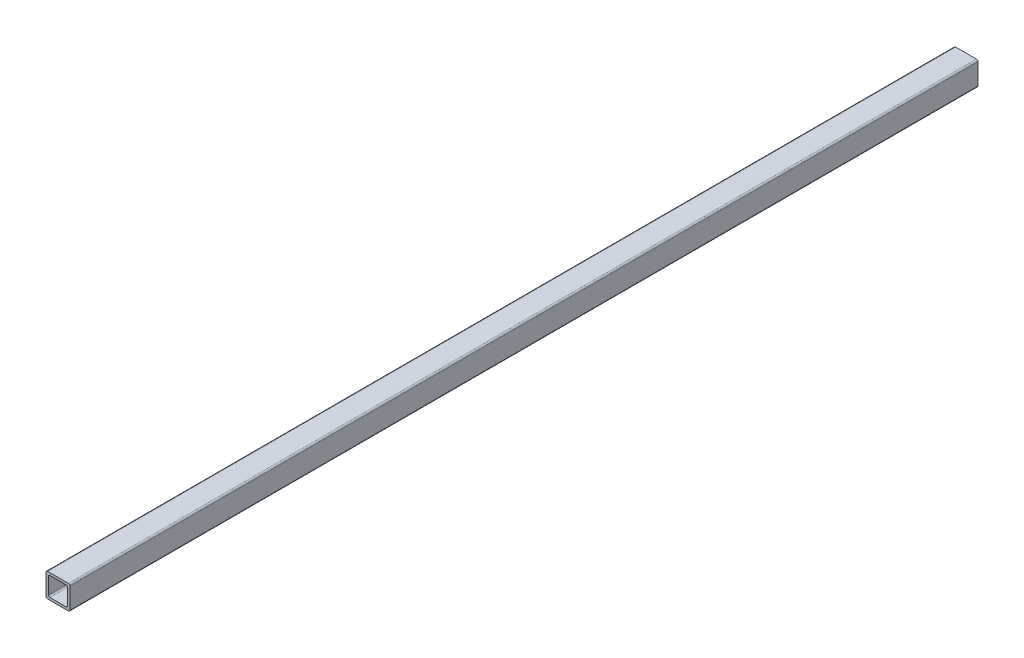
from build123d import *

# Parameters (mm, degrees)
SKETCH1_W           = 7.9
SKETCH1_H           = 7.9
SKETCH1_W_2         = 6.3
SKETCH1_H_2         = 6.3
BOSS_EXTRUDE1_DEPTH = 300
FILLET1_R           = 0.5


with BuildPart() as part:
    # Sketch1 → Boss-Extrude1 (new body)
    with BuildSketch(Plane.XY):
        Rectangle(SKETCH1_W, SKETCH1_H)
        Rectangle(SKETCH1_W_2, SKETCH1_H_2, mode=Mode.SUBTRACT)
    extrude(amount=BOSS_EXTRUDE1_DEPTH)

    # Fillet1
    fillet1_edges = [part.edges().sort_by_distance(p)[0] for p in [
        (3.95, 3.95, 150),
        (3.15, 3.15, 150),
        (3.95, -3.95, 150),
        (3.15, -3.15, 150),
        (-3.15, -3.15, 150),
        (-3.95, -3.95, 150),
        (-3.95, 3.95, 150),
        (-3.15, 3.15, 150),
    ]]
    fillet(fillet1_edges, radius=FILLET1_R)


solid = part.part
